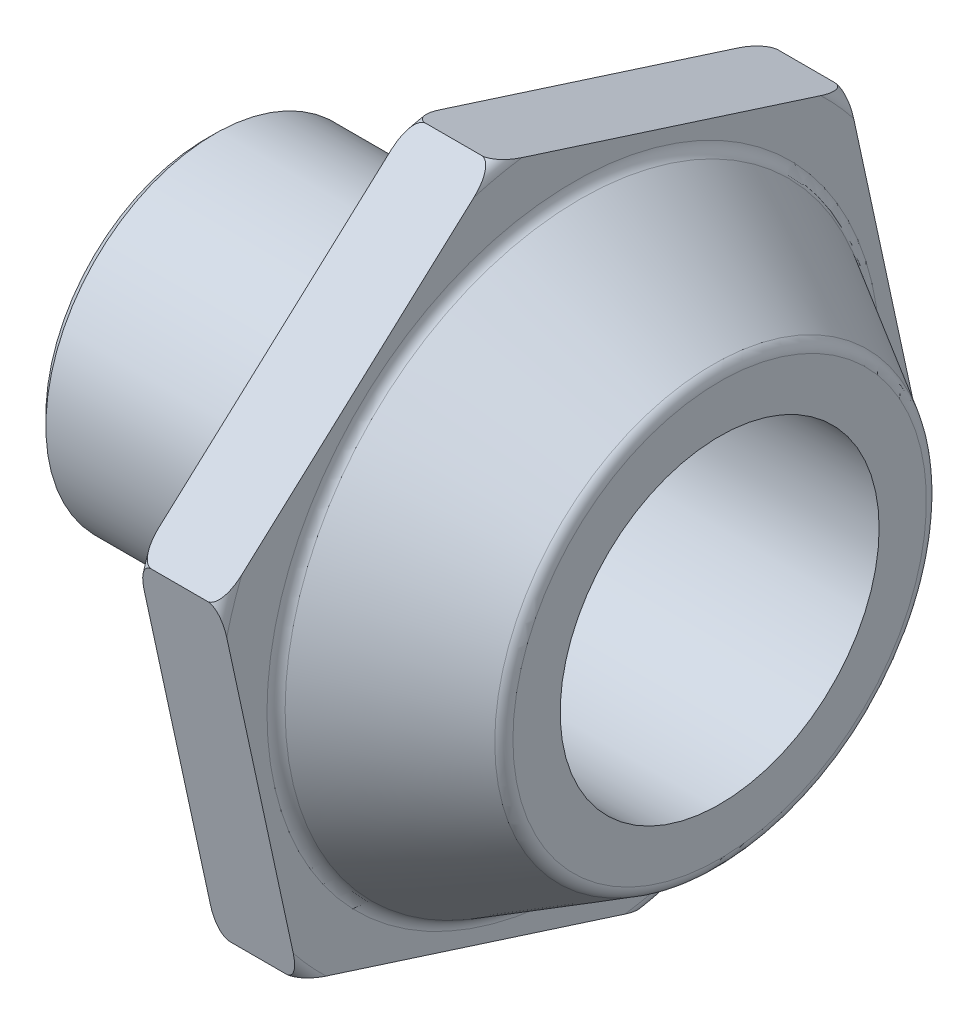
from build123d import *

# Parameters (mm, degrees)
SKETCH2_R          = 6
CUT_EXTRUDE1_DEPTH = 28.9039316
FILLET2_R          = 0.5
SKETCH3_OUTSIDE_W  = 38.688
SKETCH3_OUTSIDE_H  = 38.688
CUT_EXTRUDE2_DEPTH = 25.322177821
FILLET3_R          = 0.5
FILLET4_R          = 0.5


# Read off the part's stored shape, not the designer's step: 1/2-20 Roscas Standard Taladro1
with BuildPart() as part:
    # Sketch1 → Revolve1 (revolve)
    with BuildSketch(Plane.XY, mode=Mode.PRIVATE) as revolve1_sk:
        Polygon((13.067461121, 0), (13.067461121, 8.067459416), (7.567461121, 11.242885897), (7.567461121, 13.934625577), (4.457844976, 13.934625577), (4.457844976, 6.718847917), (3.567461121, 6.718847917), (3.567461121, 7), (-6.688090473, 7), (-6.688090473, 0), align=None)
    revolve(revolve1_sk.sketch.rotate(Axis((-1000, 0, 0), (1, 0, 0)), 90), axis=Axis((-1000, 0, 0), (1, 0, 0)))

    # Sketch2 → Cut-Extrude1 (cut, through all)
    with BuildSketch(Plane(origin=(13.067461121, 0, 0), x_dir=(0, 0, -1), z_dir=(1, 0, 0))):
        Circle(SKETCH2_R)
    extrude(amount=-CUT_EXTRUDE1_DEPTH, mode=Mode.SUBTRACT)

    # Fillet2
    fillet2_edges = [part.edges().sort_by_distance(p)[0] for p in [
        (4.457844976, 0, -13.934625577),
        (7.567461121, 0, -13.934625577),
    ]]
    fillet(fillet2_edges, radius=FILLET2_R)

    # Sketch3 outside → Cut-Extrude2 (cut, through all)
    with BuildSketch(Plane(origin=(7.567461121, 0, 0), x_dir=(0, 0, -1), z_dir=(1, 0, 0))):
        Rectangle(SKETCH3_OUTSIDE_W, SKETCH3_OUTSIDE_H)
        Polygon((10.316513684, 9.36714126), (-2.953925449, 13.617933559), (-13.270439134, 4.250792299), (-10.316513684, -9.36714126), (2.953925449, -13.617933559), (13.270439134, -4.250792299), align=None, mode=Mode.SUBTRACT)
    extrude(amount=-CUT_EXTRUDE2_DEPTH, mode=Mode.SUBTRACT)

    # Fillet3
    fillet3_edges = [part.edges().sort_by_distance(p)[0] for p in [
        (13.067461121, 0, -8.067459416),
    ]]
    fillet(fillet3_edges, radius=FILLET3_R)

    # Fillet4
    fillet4_edges = [part.edges().sort_by_distance(p)[0] for p in [
        (7.567461121, 0, -11.242885897),
    ]]
    fillet(fillet4_edges, radius=FILLET4_R)

    # 1/2-20 Roscas Standard Taladro1 outline → 1/2-20 Roscas Standard Taladro1 (revolve, cut)
    with BuildSketch(Plane.YX):
        Polygon((6.35, 3.567461121), (6.35, -5.932440473), (6, -6.282440473), (6, -6.688090473), (7, -6.688090473), (7, 3.567461121), align=None)
    revolve(axis=Axis((0, 0, 0), (1, 0, 0)), mode=Mode.SUBTRACT)


solid = part.part
